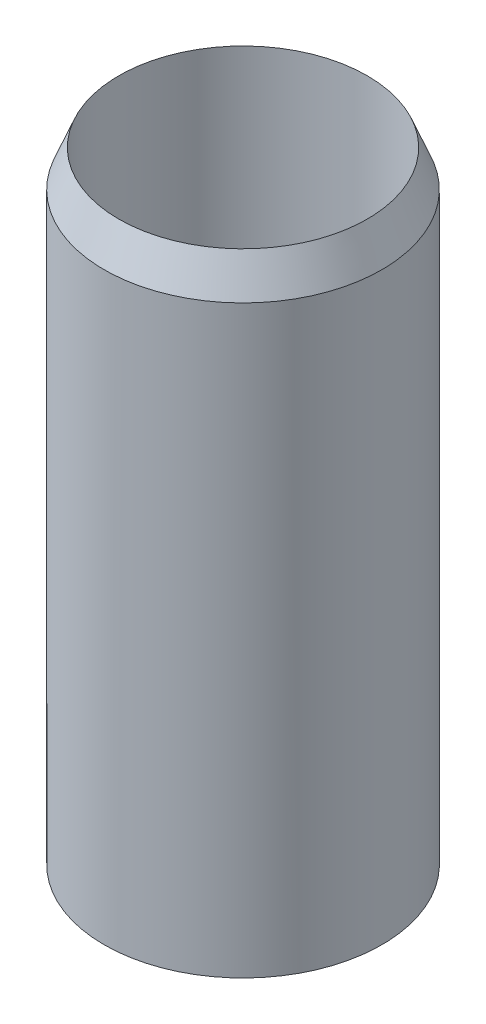
from build123d import *

# Parameters (mm, degrees)
SKETCH_1_R          = 19
SKETCH_1_R_2        = 17
EXTRUDE_1_DEPTH     = 80
SKETCH_3_R          = 19
SKETCH_2_R          = 17
CUT_EXTRUDE_START   = -5
SKETCH_4_R          = 17
CUT_EXTRUDE_1_DEPTH = 5


with BuildPart() as part:
    # Эскиз1 → Бобышка-Вытянуть1 (new body)
    with BuildSketch(Plane(origin=(0, 0, 0), x_dir=(1, 0, 0), z_dir=(0, 1, 0))):
        Circle(SKETCH_1_R)
        Circle(SKETCH_1_R_2, mode=Mode.SUBTRACT)
    extrude(amount=EXTRUDE_1_DEPTH)

    # Эскиз3 → По сечениям1 section 0
    with BuildSketch(Plane(origin=(0, 80, 0), x_dir=(1, 0, 0), z_dir=(0, 1, 0))):
        Circle(SKETCH_3_R)
    # Эскиз2 → По сечениям1 section 1
    with BuildSketch(Plane(origin=(0, 85, 0), x_dir=(1, 0, 0), z_dir=(0, 1, 0))):
        Circle(SKETCH_2_R)
    loft()

    # Эскиз4 → Вырез-Вытянуть1 (cut)
    with BuildSketch(Plane(origin=(0, 85, 0), x_dir=(1, 0, 0), z_dir=(0, 1, 0)).offset(CUT_EXTRUDE_START)):
        Circle(SKETCH_4_R)
    extrude(amount=CUT_EXTRUDE_1_DEPTH, mode=Mode.SUBTRACT)


solid = part.part
